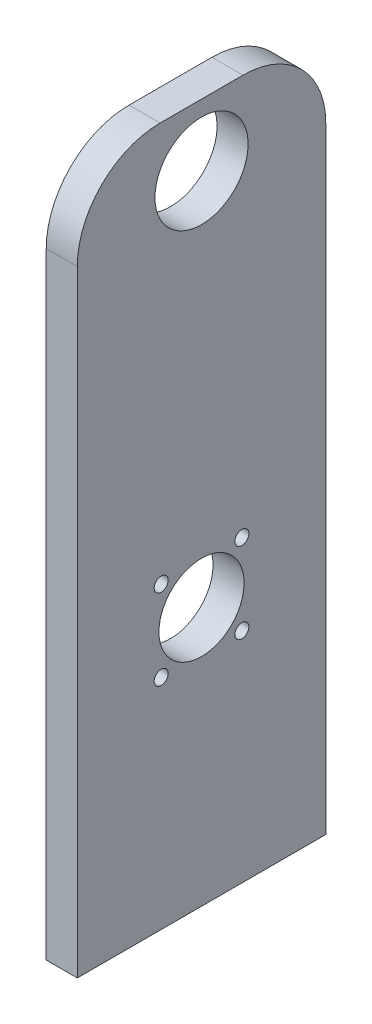
from build123d import *

# Parameters (mm, degrees)
SKETCH1_W           = 9.525
SKETCH1_H           = 76.2
BOSS_EXTRUDE1_DEPTH = 107.188
SKETCH3_R           = 14.2875
SKETCH3_R_2         = 2.1463
SKETCH3_R_3         = 13.0556
CUT_EXTRUDE2_DEPTH  = 45.974
FILLET1_R           = 25.4


with BuildPart() as part:
    # Sketch1 → Boss-Extrude1 (new, symmetric)
    with BuildSketch(Plane(origin=(0, 0, 0), x_dir=(1, 0, 0), z_dir=(0, 1, 0))):
        Rectangle(SKETCH1_W, SKETCH1_H)
    extrude(amount=BOSS_EXTRUDE1_DEPTH, both=True)

    # Sketch3 → Cut-Extrude2 (cut)
    with BuildSketch(Plane.ZY.offset(4.7625)):
        with Locations((0, 88.138)):
            Circle(SKETCH3_R)
        with Locations((-12.365845519, -15.443650505)):
            Circle(SKETCH3_R_2)
        with Locations((12.374792935, -15.443650505)):
            Circle(SKETCH3_R_2)
        with Locations((-12.365845519, -40.187792935)):
            Circle(SKETCH3_R_2)
        with Locations((12.374792935, -40.187792935)):
            Circle(SKETCH3_R_2)
        with Locations((0, -27.813)):
            Circle(SKETCH3_R_3)
    extrude(amount=-CUT_EXTRUDE2_DEPTH, mode=Mode.SUBTRACT)

    # Fillet1
    fillet1_edges = [part.edges().sort_by_distance(p)[0] for p in [
        (0, 107.188, 38.1),
        (0, 107.188, -38.1),
    ]]
    fillet(fillet1_edges, radius=FILLET1_R)


solid = part.part
